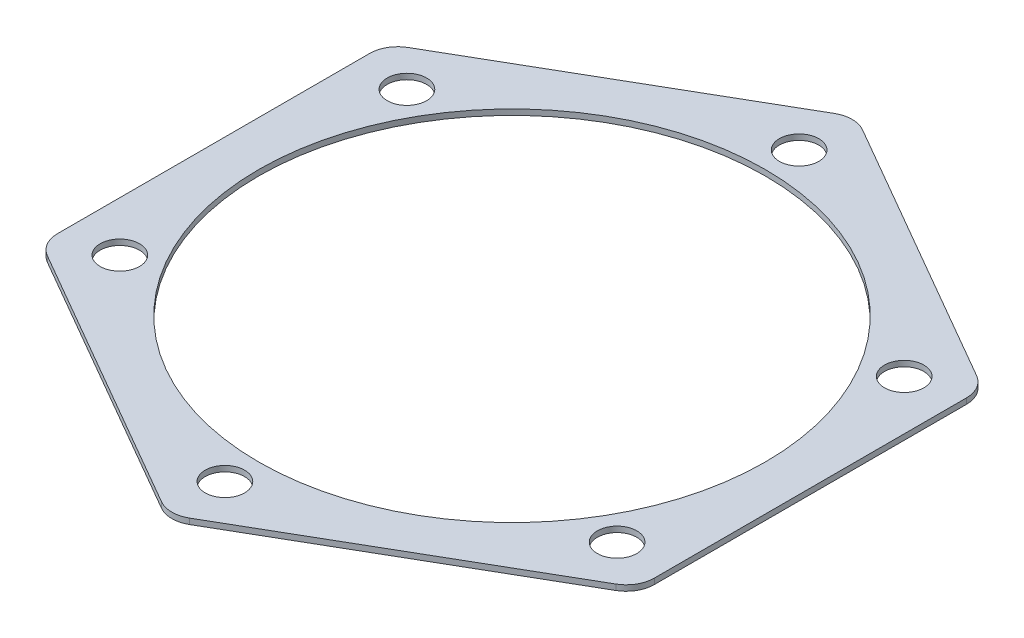
from build123d import *

# Parameters (mm, degrees)
SKETCH1_R           = 45
SKETCH1_R_2         = 3.5
BOSS_EXTRUDE1_DEPTH = 1


with BuildPart() as part:
    # Sketch1 → Boss-Extrude1 (new body)
    with BuildSketch(Plane(origin=(0, 0, 0), x_dir=(1, 0, 0), z_dir=(0, 1, 0))):
        with BuildLine():
            Line((-50.5, -32.04293994), (-2.5, -59.755752861))
            ThreePointArc((-2.5, -59.755752861), (0, -60.425625842), (2.5, -59.755752861))
            Line((2.5, -59.755752861), (50.5, -32.04293994))
            ThreePointArc((50.5, -32.04293994), (52.330127019, -30.212812921), (53, -27.712812921))
            Line((53, -27.712812921), (53, 27.712812921))
            ThreePointArc((53, 27.712812921), (52.330127019, 30.212812921), (50.5, 32.04293994))
            Line((50.5, 32.04293994), (2.5, 59.755752861))
            ThreePointArc((2.5, 59.755752861), (0, 60.425625842), (-2.5, 59.755752861))
            Line((-2.5, 59.755752861), (-50.5, 32.04293994))
            ThreePointArc((-50.5, 32.04293994), (-52.330127019, 30.212812921), (-53, 27.712812921))
            Line((-53, 27.712812921), (-53, -27.712812921))
            ThreePointArc((-53, -27.712812921), (-52.330127019, -30.212812921), (-50.5, -32.04293994))
        make_face()
        Circle(SKETCH1_R, mode=Mode.SUBTRACT)
        with Locations((0, 51)):
            Circle(SKETCH1_R_2, mode=Mode.SUBTRACT)
        with Locations((44.167295593, 25.5)):
            Circle(SKETCH1_R_2, mode=Mode.SUBTRACT)
        with Locations((44.167295593, -25.5)):
            Circle(SKETCH1_R_2, mode=Mode.SUBTRACT)
        with Locations((0, -51)):
            Circle(SKETCH1_R_2, mode=Mode.SUBTRACT)
        with Locations((-44.167295593, -25.5)):
            Circle(SKETCH1_R_2, mode=Mode.SUBTRACT)
        with Locations((-44.167295593, 25.5)):
            Circle(SKETCH1_R_2, mode=Mode.SUBTRACT)
    extrude(amount=BOSS_EXTRUDE1_DEPTH)


solid = part.part
